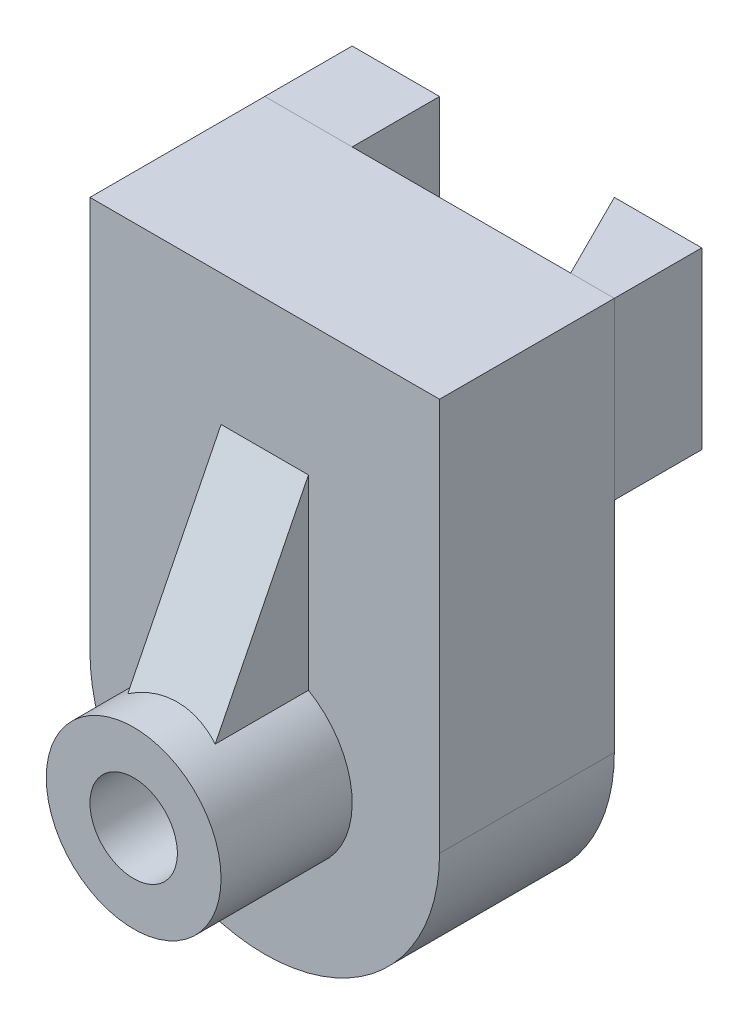
from build123d import *

# Parameters (mm, degrees)
BOSS_EXTRUDE1_DEPTH   = 65
BOSS_EXTRUDE2_DEPTH   = 20
SKETCH1_4_W           = 10
SKETCH1_4_H           = 10
BOSS_EXTRUDE2_2_DEPTH = 20
FILLET1_R             = 20
SKETCH3_R             = 10
BOSS_EXTRUDE3_DEPTH   = 15
RIB3_REACH            = 78.485
SKETCH5_WALL_W        = 177.331265182
SKETCH5_WALL_H        = 10


with BuildPart() as part:
    # Sketch1 → Boss-Extrude1 (new body)
    with BuildSketch(Plane(origin=(0, 0, 0), x_dir=(-1, 0, 0), z_dir=(0, 1, 0))):
        Polygon((0, 20), (0, 0), (10, 0), (20, 0), (20, 20), align=None)
        Polygon((-15, 0), (0, 0), (0, 20), (-20, 20), (-20, 0), align=None)
    extrude(amount=-BOSS_EXTRUDE1_DEPTH)

    # Fillet1
    fillet1_edges = [part.edges().sort_by_distance(p)[0] for p in [
        (-20, -65, 10),
        (20, -65, 10),
    ]]
    fillet(fillet1_edges, radius=FILLET1_R - 0.0001)  # a hair under: the kernel refuses the full size

    # Sketch3 → Boss-Extrude3 (add)
    with BuildSketch(Plane.XY.offset(20)):
        with Locations(Location((0, -45, 0), (0, 0, 180))):
            Circle(SKETCH3_R)
    extrude(amount=BOSS_EXTRUDE3_DEPTH)

    # Sketch5 wall → Rib3 (add, up to next)
    with BuildSketch(Plane(origin=(0, -25, 25), x_dir=(0, 0.894427191, -0.4472135955), z_dir=(0, 0.4472135955, 0.894427191)), mode=Mode.PRIVATE) as rib3_sk1:
        Rectangle(SKETCH5_WALL_W, SKETCH5_WALL_H)
    rib3_tool1 = extrude(rib3_sk1.sketch, amount=-RIB3_REACH, mode=Mode.PRIVATE) - part.part
    add(rib3_tool1.solids().sort_by_distance((0, -25, 25))[0])

    # Sketch8 → Ø10.0 (10) Diameter Hole1 (revolve, cut)
    with BuildSketch(Plane(origin=(0, -45, 0), x_dir=(0, 1, 0), z_dir=(1, 0, 0))):
        Polygon((0, 0), (0, 35), (5, 35), (5, 5), (10, 0), align=None)
    revolve(axis=Axis((0, -45, -6.35), (0, 0, 1)), mode=Mode.SUBTRACT)


with BuildPart() as body_2:
    # Sketch1<4> → Boss-Extrude2 (new body)
    with BuildSketch(Plane(origin=(0, 0, 0), x_dir=(-1, 0, 0), z_dir=(0, 1, 0))):
        Polygon((-10, -10), (-15, 0), (-20, 0), (-20, -10), align=None)
    extrude(amount=-BOSS_EXTRUDE2_DEPTH)


with BuildPart() as body_3:
    # Sketch1<4> → Boss-Extrude2 2 (new body)
    with BuildSketch(Plane(origin=(0, 0, 0), x_dir=(-1, 0, 0), z_dir=(0, 1, 0))):
        with Locations((15, -5)):
            Rectangle(SKETCH1_4_W, SKETCH1_4_H)
    extrude(amount=-BOSS_EXTRUDE2_2_DEPTH)


solid = Compound([part.part, body_2.part, body_3.part])
